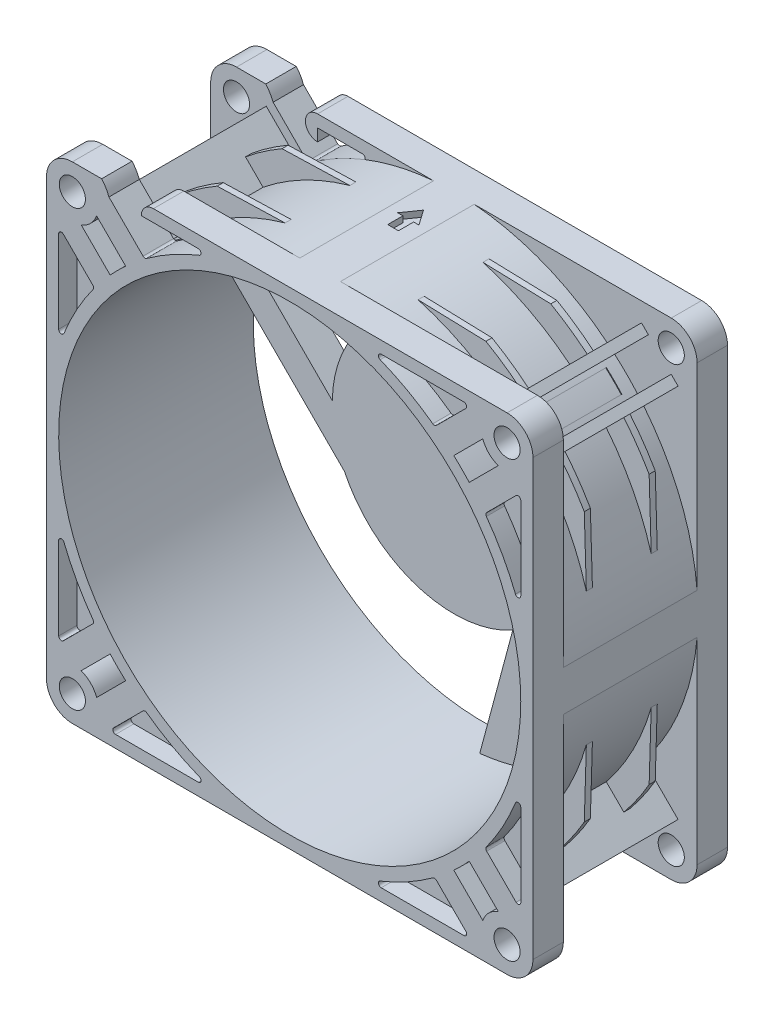
from build123d import *

# Parameters (mm, degrees)
SKETCH_BODY_R                       = 38
BODY_DEPTH                          = 32
SKETCH_CUT_BODY_W                   = 22
SKETCH_CUT_BODY_H                   = 14.668494336
REINFORCMENT_STRIP_REACH            = 66.992
CIRPATTERN_REINFORCMENT_STRIP_COUNT = 4
SKETCH_FIXING_HOLE_R                = 2.15
FIXING_HOLE_DEPTH                   = 65.992307237
CIRPATTERN_FIXING_HOLE_COUNT        = 4
BONE_DEPTH                          = 5
CIRPATTERN_BONE_COUNT               = 3
CUT_REINFORCMENT_STRIP_HOLE_1_DEPTH = 3
EXTRA_SUPPORT_1_DEPTH               = 0.5
EXTRA_SUPPORT_2_DEPTH               = 0.5
CUT_HOLE_2_DEPTH                    = 25
CIRPATTERN_COUNT                    = 4
FIXING_PLATE_FAN_DEPTH              = 5
AIR_EXHAUST_DEPTH                   = 95.154128959
CUT_CABLE1_START                    = 5
CUT_CABLE1_DEPTH                    = 5
CUT_CABLE2_DEPTH                    = 5


# Read off the part's stored shape, not the designer's step: Fixing-Plate-Fan
with BuildPart() as part:
    # Sketch-Body → Body (new body)
    with BuildSketch(Plane.XY):
        with BuildLine():
            Line((-35.75, -40), (35.75, -40))
            ThreePointArc((35.75, -40), (38.75520382, -38.75520382), (40, -35.75))
            Line((40, -35.75), (40, 35.75))
            ThreePointArc((40, 35.75), (38.75520382, 38.75520382), (35.75, 40))
            Line((35.75, 40), (-35.75, 40))
            ThreePointArc((-35.75, 40), (-38.75520382, 38.75520382), (-40, 35.75))
            Line((-40, 35.75), (-40, -35.75))
            ThreePointArc((-40, -35.75), (-38.75520382, -38.75520382), (-35.75, -40))
        make_face()
        Circle(SKETCH_BODY_R, mode=Mode.SUBTRACT)
    extrude(amount=BODY_DEPTH)

    # Sketch-Cut-Body → Cut-Body (revolve, cut)
    with BuildSketch(Plane(origin=(0, 0, 0), x_dir=(0, 0, -1), z_dir=(1, 0, 0))):
        with Locations((-16, 47.473887687)):
            Rectangle(SKETCH_CUT_BODY_W, SKETCH_CUT_BODY_H)
    revolve(axis=Axis((0, 0, 32), (0, 0, -1)), mode=Mode.SUBTRACT)

    # Sketch-Reinforcment-Strip → Reinforcment-Strip (add, up to next)
    with BuildSketch(Plane.XY, mode=Mode.PRIVATE) as reinforcment_strip_sk1:
        with BuildLine():
            Line((31.129370474, 25.118962834), (36.871756216, 30.861348576))
            Line((36.871756216, 30.861348576), (35.743512432, 31.98959236))
            Line((35.743512432, 31.98959236), (30.09888451, 26.344964438))
            ThreePointArc((30.09888451, 26.344964438), (30.620264076, 25.737121593), (31.129370474, 25.118962834))
        make_face()
    reinforcment_strip_tool1 = extrude(reinforcment_strip_sk1.sketch, amount=REINFORCMENT_STRIP_REACH, mode=Mode.PRIVATE) - part.part
    # Sketch-Reinforcment-Strip → Reinforcment-Strip (add, up to next)
    with BuildSketch(Plane.XY, mode=Mode.PRIVATE) as reinforcment_strip_sk2:
        with BuildLine():
            Line((25.118962834, 31.129370474), (30.861348576, 36.871756216))
            Line((30.861348576, 36.871756216), (31.98959236, 35.743512432))
            Line((31.98959236, 35.743512432), (26.344964438, 30.09888451))
            ThreePointArc((26.344964438, 30.09888451), (25.737121593, 30.620264076), (25.118962834, 31.129370474))
        make_face()
    reinforcment_strip_tool2 = extrude(reinforcment_strip_sk2.sketch, amount=REINFORCMENT_STRIP_REACH, mode=Mode.PRIVATE) - part.part
    reinforcment_strip_1 = reinforcment_strip_tool1.solids().sort_by_distance((33.464323, 28.578928, 0))[0]
    add(reinforcment_strip_1)
    reinforcment_strip_2 = reinforcment_strip_tool2.solids().sort_by_distance((28.578928, 33.464323, 0))[0]
    add(reinforcment_strip_2)
    reinforcment_strip = reinforcment_strip_1 + reinforcment_strip_2  # Reinforcment-Strip as one shape, for the pattern or mirror that repeats it

    # CirPattern-Reinforcment-Strip: Reinforcment-Strip ×4 about axis
    cirpattern_reinforcment_strip_axis = Axis((0, 0, 0), (0, 0, 1))
    for i in range(1, CIRPATTERN_REINFORCMENT_STRIP_COUNT):
        add(reinforcment_strip.rotate(cirpattern_reinforcment_strip_axis, i * 360 / CIRPATTERN_REINFORCMENT_STRIP_COUNT))

    # Sketch-Fixing-Hole → Fixing-Hole (cut, through all)
    with BuildSketch(Plane.XY):
        with Locations(Location((35.75, 35.75, 0), (0, 0, 90))):
            Circle(SKETCH_FIXING_HOLE_R)
    fixing_hole = extrude(amount=FIXING_HOLE_DEPTH, mode=Mode.SUBTRACT)

    # CirPattern-Fixing-Hole: Fixing-Hole ×4 about axis
    cirpattern_fixing_hole_axis = Axis((0, 0, 0), (0, 0, 1))
    for i in range(1, CIRPATTERN_FIXING_HOLE_COUNT):
        add(fixing_hole.rotate(cirpattern_fixing_hole_axis, i * 360 / CIRPATTERN_FIXING_HOLE_COUNT), mode=Mode.SUBTRACT)

    # Sketch-Bone → Bone (add)
    with BuildSketch(Plane.XY):
        with BuildLine():
            Line((-18.012303025, -8.692349494), (-36.670031624, 9.965379104))
            ThreePointArc((-36.670031624, 9.965379104), (-35.845244902, 12.614214915), (-34.829400932, 15.195816224))
            Line((-34.829400932, 15.195816224), (-19.99670335, 0.363118642))
            ThreePointArc((-19.99670335, 0.363118642), (-19.536415157, -4.281177736), (-18.012303025, -8.692349494))
        make_face()
    bone = extrude(amount=BONE_DEPTH)

    # CirPattern-Bone: Bone ×3 about axis
    cirpattern_bone_axis = Axis((0, 0, 0), (0, 0, 1))
    for i in range(1, CIRPATTERN_BONE_COUNT):
        add(bone.rotate(cirpattern_bone_axis, i * 360 / CIRPATTERN_BONE_COUNT))

    # Sketch1 → Cut-Reinforcment-Strip-Hole-1 (cut)
    with BuildSketch(Plane.XY.offset(32)):
        with BuildLine():
            Line((37.231716673, 28.964821465), (32.387399665, 24.120504457))
            ThreePointArc((32.387399665, 24.120504457), (32.256956267, 23.837401058), (32.341747985, 23.537445428))
            ThreePointArc((32.341747985, 23.537445428), (35.006069993, 19.353941812), (37.132166799, 14.872867538))
            ThreePointArc((37.132166799, 14.872867538), (37.63516046, 14.598296214), (38, 15.040205872))
            Line((38, 15.040205872), (38, 28.646588092))
            ThreePointArc((38, 28.646588092), (37.722176708, 29.062380032), (37.231716673, 28.964821465))
        make_face()
        with BuildLine():
            Line((28.646588092, 38), (15.040205872, 38))
            ThreePointArc((15.040205872, 38), (14.598296214, 37.63516046), (14.872867538, 37.132166799))
            ThreePointArc((14.872867538, 37.132166799), (19.353941812, 35.006069993), (23.537445428, 32.341747985))
            ThreePointArc((23.537445428, 32.341747985), (23.837401058, 32.256956267), (24.120504457, 32.387399665))
            Line((24.120504457, 32.387399665), (28.964821465, 37.231716673))
            ThreePointArc((28.964821465, 37.231716673), (29.062380032, 37.722176708), (28.646588092, 38))
        make_face()
    cut_reinforcment_strip_hole_1 = extrude(amount=-CUT_REINFORCMENT_STRIP_HOLE_1_DEPTH, mode=Mode.SUBTRACT)

    # Sketch5 → Extra-Support-1 (add, symmetric)
    with BuildSketch(Plane.XY.offset(10.666666667)):
        with BuildLine():
            Line((38.281845343, 22.102033714), (38.637033052, 10.352761804))
            ThreePointArc((38.637033052, 10.352761804), (35.655966379, 18.128763376), (31.129370474, 25.118962834))
            Line((31.129370474, 25.118962834), (34.117396584, 28.106988944))
            ThreePointArc((34.117396584, 28.106988944), (36.323923655, 25.1907155), (38.281845343, 22.102033714))
        make_face()
        with BuildLine():
            Line((25.118962834, 31.129370474), (28.106988944, 34.117396584))
            ThreePointArc((28.106988944, 34.117396584), (25.1907155, 36.323923655), (22.102033714, 38.281845343))
            Line((22.102033714, 38.281845343), (10.352761804, 38.637033052))
            ThreePointArc((10.352761804, 38.637033052), (18.128763376, 35.655966379), (25.118962834, 31.129370474))
        make_face()
    extra_support_1 = extrude(amount=EXTRA_SUPPORT_1_DEPTH, both=True)

    # Sketch6 → Extra-Support-2 (add, symmetric)
    with BuildSketch(Plane.XY.offset(21.333333333)):
        with BuildLine():
            Line((38.281845343, 22.102033714), (38.637033052, 10.352761804))
            ThreePointArc((38.637033052, 10.352761804), (35.655966379, 18.128763376), (31.129370474, 25.118962834))
            Line((31.129370474, 25.118962834), (34.117396584, 28.106988944))
            ThreePointArc((34.117396584, 28.106988944), (36.323923655, 25.1907155), (38.281845343, 22.102033714))
        make_face()
        with BuildLine():
            Line((25.118962834, 31.129370474), (28.106988944, 34.117396584))
            ThreePointArc((28.106988944, 34.117396584), (25.1907155, 36.323923655), (22.102033714, 38.281845343))
            Line((22.102033714, 38.281845343), (10.352761804, 38.637033052))
            ThreePointArc((10.352761804, 38.637033052), (18.128763376, 35.655966379), (25.118962834, 31.129370474))
        make_face()
    extra_support_2 = extrude(amount=EXTRA_SUPPORT_2_DEPTH, both=True)

    # Sketch10 → Cut-Hole-2 (cut)
    with BuildSketch(Plane.XY.offset(32)):
        with BuildLine():
            Line((26.982679051, 29.52854604), (31.754771459, 34.300638448))
            ThreePointArc((31.754771459, 34.300638448), (32.74479618, 32.74479618), (34.300638448, 31.754771459))
            Line((34.300638448, 31.754771459), (29.52854604, 26.982679051))
            ThreePointArc((29.52854604, 26.982679051), (28.284271247, 28.284271247), (26.982679051, 29.52854604))
        make_face()
    cut_hole_2 = extrude(amount=-CUT_HOLE_2_DEPTH, mode=Mode.SUBTRACT)

    # CirPattern: Cut-Reinforcment-Strip-Hole-1, Extra-Support-1, Extra-Support-2, Cut-Hole-2 ×4 about axis
    cirpattern_axis = Axis((0, 0, 0), (0, 0, 1))
    add([cut_reinforcment_strip_hole_1.rotate(cirpattern_axis, i * 360 / CIRPATTERN_COUNT) for i in range(1, CIRPATTERN_COUNT)], mode=Mode.SUBTRACT)
    add([extra_support_1.rotate(cirpattern_axis, i * 360 / CIRPATTERN_COUNT) for i in range(1, CIRPATTERN_COUNT)])
    add([extra_support_2.rotate(cirpattern_axis, i * 360 / CIRPATTERN_COUNT) for i in range(1, CIRPATTERN_COUNT)])
    add([cut_hole_2.rotate(cirpattern_axis, i * 360 / CIRPATTERN_COUNT) for i in range(1, CIRPATTERN_COUNT)], mode=Mode.SUBTRACT)

    # Fixing-Plate-Fan outline → Fixing-Plate-Fan (add)
    with BuildSketch(Plane.XY):
        with BuildLine():
            ThreePointArc((1.478356032, 19.945286748), (-13.475816256, 14.778442957), (-19.99670335, 0.363118642))
            ThreePointArc((-19.99670335, 0.363118642), (-19.536415157, -4.281177736), (-18.012303025, -8.692349494))
            ThreePointArc((-18.012303025, -8.692349494), (-6.060598901, -19.059620693), (9.683881706, -17.499212414))
            ThreePointArc((9.683881706, -17.499212414), (13.475816256, -14.778442957), (16.533946993, -11.252937253))
            ThreePointArc((16.533946993, -11.252937253), (19.536415157, 4.281177737), (10.312821643, 17.136093772))
            ThreePointArc((10.312821643, 17.136093772), (6.060598901, 19.059620693), (1.478356032, 19.945286748))
        make_face()
    extrude(amount=FIXING_PLATE_FAN_DEPTH)

    # Sketch4 → Air-Exhaust (cut, through all)
    with BuildSketch(Plane(origin=(0, 39, 0), x_dir=(-1, 0, 0), z_dir=(0, 1, 0))):
        Polygon((0.881634904, 15), (-0.881634904, 15), (-0.881634904, 12.5), (-1.750518846, 12.5), (0, 10), (1.750518846, 12.5), (0.881634904, 12.5), align=None)
    extrude(amount=AIR_EXHAUST_DEPTH, mode=Mode.SUBTRACT)

    # Sketch12 → Cut-Cable1 (cut)
    with BuildSketch(Plane.XY.offset(CUT_CABLE1_START)):
        with BuildLine():
            Line((-29.733104792, 38), (-24.120504457, 32.387399665))
            ThreePointArc((-24.120504457, 32.387399665), (-23.837401058, 32.256956267), (-23.537445428, 32.341747985))
            ThreePointArc((-23.537445428, 32.341747985), (-19.353941812, 35.006069993), (-14.872867538, 37.132166799))
            ThreePointArc((-14.872867538, 37.132166799), (-14.598296214, 37.63516046), (-15.040205872, 38))
            Line((-15.040205872, 38), (-22.416780472, 38))
            Line((-22.416780472, 38), (-22.416780472, 36))
            ThreePointArc((-22.416780472, 36), (-24.416780472, 38), (-22.416780472, 40))
            Line((-22.416780472, 40), (-30.933047857, 40))
            ThreePointArc((-30.933047857, 40), (-30.241546306, 39.054915406), (-29.733104792, 38))
        make_face()
    extrude(amount=-CUT_CABLE1_DEPTH, mode=Mode.SUBTRACT)

    # Sketch11 → Cut-Cable2 (cut)
    with BuildSketch(Plane.XY.offset(32)):
        with BuildLine():
            Line((-29.733104792, 38), (-24.120504457, 32.387399665))
            ThreePointArc((-24.120504457, 32.387399665), (-23.837401058, 32.256956267), (-23.537445428, 32.341747985))
            ThreePointArc((-23.537445428, 32.341747985), (-19.353941812, 35.006069993), (-14.872867538, 37.132166799))
            ThreePointArc((-14.872867538, 37.132166799), (-14.598296214, 37.63516046), (-15.040205872, 38))
            Line((-15.040205872, 38), (-22.416780472, 38))
            Line((-22.416780472, 38), (-22.416780472, 36))
            ThreePointArc((-22.416780472, 36), (-24.416780472, 38), (-22.416780472, 40))
            Line((-22.416780472, 40), (-30.933047857, 40))
            ThreePointArc((-30.933047857, 40), (-30.241546306, 39.054915406), (-29.733104792, 38))
        make_face()
    extrude(amount=-CUT_CABLE2_DEPTH, mode=Mode.SUBTRACT)


solid = part.part
